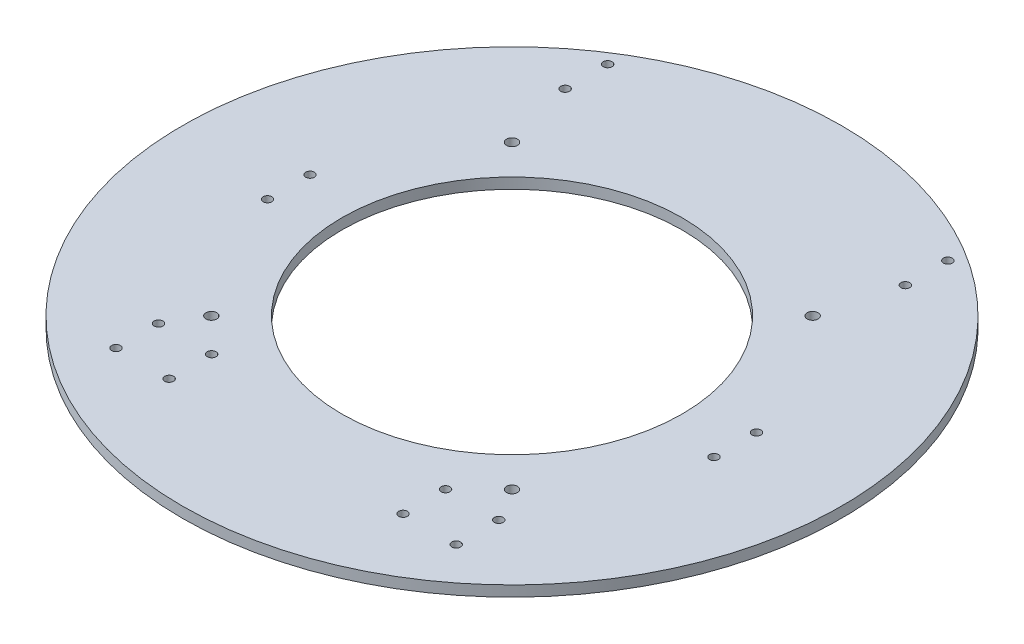
from build123d import *

# Parameters (mm, degrees)
SKETCH1_R           = 196.85
SKETCH1_R_2         = 101.6
SKETCH1_R_3         = 2.6289
SKETCH1_R_4         = 3.2639
BOSS_EXTRUDE1_DEPTH = 6.35


with BuildPart() as part:
    # Sketch1 → Boss-Extrude1 (new body)
    with BuildSketch(Plane(origin=(0, 0, 0), x_dir=(1, 0, 0), z_dir=(0, 1, 0))):
        Circle(SKETCH1_R)
        Circle(SKETCH1_R_2, mode=Mode.SUBTRACT)
        with Locations((69.85, -109.5375)):
            Circle(SKETCH1_R_3, mode=Mode.SUBTRACT)
        with Locations((69.85, -134.9375)):
            Circle(SKETCH1_R_3, mode=Mode.SUBTRACT)
        with Locations((101.6, -109.5375)):
            Circle(SKETCH1_R_3, mode=Mode.SUBTRACT)
        with Locations((101.6, -134.9375)):
            Circle(SKETCH1_R_3, mode=Mode.SUBTRACT)
        with Locations((89.802561211, -89.802561211)):
            Circle(SKETCH1_R_4, mode=Mode.SUBTRACT)
        with Locations((101.6, 133.35)):
            Circle(SKETCH1_R_3, mode=Mode.SUBTRACT)
        with Locations((101.6, 158.75)):
            Circle(SKETCH1_R_3, mode=Mode.SUBTRACT)
        with Locations((89.802561211, 89.802561211)):
            Circle(SKETCH1_R_4, mode=Mode.SUBTRACT)
        with Locations((133.35, -12.7)):
            Circle(SKETCH1_R_3, mode=Mode.SUBTRACT)
        with Locations((133.35, 12.7)):
            Circle(SKETCH1_R_3, mode=Mode.SUBTRACT)
        with Locations((-69.85, -134.9375)):
            Circle(SKETCH1_R_3, mode=Mode.SUBTRACT)
        with Locations((-101.6, -134.9375)):
            Circle(SKETCH1_R_3, mode=Mode.SUBTRACT)
        with Locations((-101.6, -109.5375)):
            Circle(SKETCH1_R_3, mode=Mode.SUBTRACT)
        with Locations((-89.802561211, -89.802561211)):
            Circle(SKETCH1_R_4, mode=Mode.SUBTRACT)
        with Locations((-69.85, -109.5375)):
            Circle(SKETCH1_R_3, mode=Mode.SUBTRACT)
        with Locations((-133.35, -12.7)):
            Circle(SKETCH1_R_3, mode=Mode.SUBTRACT)
        with Locations((-133.35, 12.7)):
            Circle(SKETCH1_R_3, mode=Mode.SUBTRACT)
        with Locations((-89.802561211, 89.802561211)):
            Circle(SKETCH1_R_4, mode=Mode.SUBTRACT)
        with Locations((-101.6, 158.75)):
            Circle(SKETCH1_R_3, mode=Mode.SUBTRACT)
        with Locations((-101.6, 133.35)):
            Circle(SKETCH1_R_3, mode=Mode.SUBTRACT)
    extrude(amount=BOSS_EXTRUDE1_DEPTH)


solid = part.part
